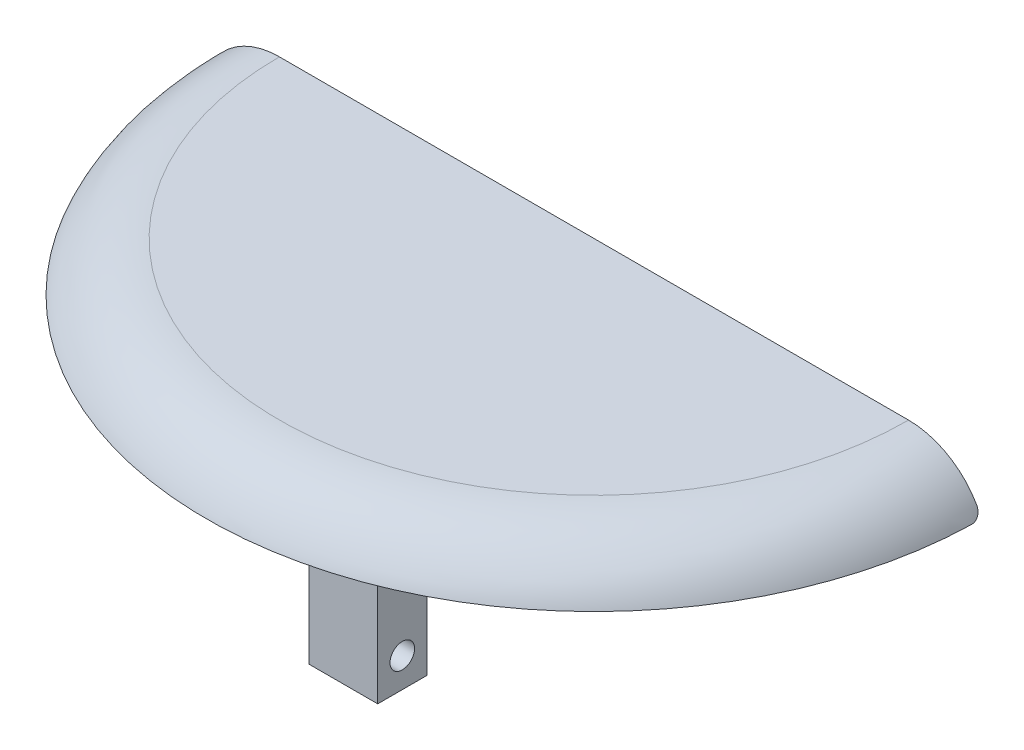
from build123d import *

# Parameters (mm, degrees)
CUT_EXTRUDE3_DEPTH           = 60
CUT_EXTRUDE5_DEPTH           = 2
CUT_EXTRUDE5_DEPTH_BACK      = 30
SKETCH9_R                    = 38
SKETCH9_R_2                  = 23
SKETCH19_W                   = 12
SKETCH19_H                   = 36.5
CUT_REVOLVE2_ANGLE           = 65
CUT_REVOLVE2_OTHER_WAY_ANGLE = 65
SKETCH21_W                   = 3.25
SKETCH21_H                   = 4
BOSS_EXTRUDE3_DEPTH          = 1.35
CIRPATTERN1_COUNT            = 5
CUT_EXTRUDE9_START           = -5
CUT_EXTRUDE9_DEPTH           = 5
SKETCH23_R                   = 10.5
CUT_EXTRUDE10_DEPTH          = 10
SKETCH24_W                   = 15
SKETCH24_H                   = 8
BOSS_EXTRUDE4_DEPTH          = 8
SKETCH26_W                   = 10
SKETCH26_H                   = 6
CUT_EXTRUDE11_DEPTH          = 10
SKETCH27_W                   = 4
SKETCH27_H                   = 5
CUT_EXTRUDE12_DEPTH          = 5
CUT_EXTRUDE14_DEPTH          = 2
CUT_EXTRUDE14_DEPTH_BACK     = 30
SKETCH29_R                   = 1
CUT_EXTRUDE15_DEPTH          = 15
FILLET1_R                    = 6
FILLET2_R                    = 8
INTERSECT1_DEPTH             = 58.427876097
SKETCH31_W                   = 7
SKETCH31_H                   = 5
BOSS_EXTRUDE7_DEPTH          = 15
SKETCH32_R                   = 1.25
CUT_EXTRUDE16_DEPTH          = 7.5
FILLET3_R                    = 1


# Read off the part's stored shape, not the designer's step: Cut-Extrude9, Intersect1
with BuildPart() as part:
    # Sketch1 → Revolve1 (revolve)
    with BuildSketch(Plane.XY, mode=Mode.PRIVATE) as revolve1_sk:
        with BuildLine():
            Line((0, 63.427876097), (32, 63.427876097))
            ThreePointArc((32, 63.427876097), (37.656854249, 61.084730346), (40, 55.427876097))
            Line((40, 55.427876097), (40, 28.846818009))
            ThreePointArc((40, 28.846818009), (38.792081772, 24.082439968), (35.460140376, 20.469057744))
            Line((35.460140376, 20.469057744), (28.539859624, 15.958818353))
            ThreePointArc((28.539859624, 15.958818353), (25.207918228, 12.345436129), (24, 7.581058088))
            Line((24, 7.581058088), (24, 3.25))
            Line((24, 3.25), (24.35, 3))
            Line((24.35, 3), (24.35, 0))
            Line((24.35, 0), (22.5, 0))
            Line((22.5, 0), (22.5, 12.5))
            ThreePointArc((22.5, 12.5), (22.353553391, 12.853553391), (22, 13))
            Line((22, 13), (0, 13))
            Line((0, 13), (0, 63.427876097))
        make_face()
    revolve(revolve1_sk.sketch.rotate(Axis((0, 0, 0), (0, 1, 0)), 90), axis=Axis((0, 0, 0), (0, 1, 0)))

    # Sketch11 → Cut-Extrude3 (cut)
    with BuildSketch(Plane(origin=(0, 13, 0), x_dir=(-1, 0, 0), z_dir=(0, -1, 0))):
        with BuildLine():
            Line((-21, 0), (21, 0))
            ThreePointArc((21, 0), (0, 21), (-21, 0))
        make_face()
    extrude(amount=-CUT_EXTRUDE3_DEPTH, mode=Mode.SUBTRACT)

    # Sketch9 → Cut-Extrude5 (cut, two sides: drawn at the far end of the back side and taken through both)
    with BuildSketch(Plane(origin=(0, 55.427876097, 0), x_dir=(1, 0, 0), z_dir=(0, 1, 0)).offset(-CUT_EXTRUDE5_DEPTH_BACK)):
        with Locations(Location((0, 0, 0), (0, 0, 270))):
            Circle(SKETCH9_R)
        with Locations(Location((0, 0, 0), (0, 0, 270))):
            Circle(SKETCH9_R_2, mode=Mode.SUBTRACT)
    extrude(amount=CUT_EXTRUDE5_DEPTH + CUT_EXTRUDE5_DEPTH_BACK, mode=Mode.SUBTRACT)

    # Sketch19 → Cut-Revolve2 (revolve, cut)
    with BuildSketch(Plane(origin=(0, 0, 0), x_dir=(0, 0, -1), z_dir=(1, 0, 0))):
        with Locations((-41.064715832, 37.177876097)):
            Rectangle(SKETCH19_W, SKETCH19_H)
    revolve(axis=Axis((0, 0, 0), (0, 1, 0)), revolution_arc=CUT_REVOLVE2_ANGLE, mode=Mode.SUBTRACT)

    # Sketch19 → Cut-Revolve2 other way (revolve, cut)
    with BuildSketch(Plane(origin=(0, 0, 0), x_dir=(0, 0, -1), z_dir=(1, 0, 0))):
        with Locations((-41.064715832, 37.177876097)):
            Rectangle(SKETCH19_W, SKETCH19_H)
    revolve(axis=Axis((0, 0, 0), (0, -1, 0)), revolution_arc=CUT_REVOLVE2_OTHER_WAY_ANGLE, mode=Mode.SUBTRACT)

    # Sketch21 → Boss-Extrude3 (add)
    with BuildSketch(Plane(origin=(0, 0, 22.5), x_dir=(-1, 0, 0), z_dir=(0, 0, -1))):
        with Locations((0, 2)):
            Rectangle(SKETCH21_W, SKETCH21_H)
    boss_extrude3 = extrude(amount=BOSS_EXTRUDE3_DEPTH)

    # CirPattern1: Boss-Extrude3 ×5 about axis
    cirpattern1_axis = Axis((0, 0, 0), (0, 1, 0))
    for i in range(1, CIRPATTERN1_COUNT):
        add(boss_extrude3.rotate(cirpattern1_axis, i * 360 / CIRPATTERN1_COUNT))

    # Cut-Extrude9 outline → Cut-Extrude9 (cut)
    with BuildSketch(Plane(origin=(0, 63.427876097, 0), x_dir=(1, 0, 0), z_dir=(0, 1, 0)).offset(CUT_EXTRUDE9_START)):
        with BuildLine():
            ThreePointArc((40, 0), (0, 40), (-40, 0))
            Line((-40, 0), (-21, 0))
            ThreePointArc((-21, 0), (0, 21), (21, 0))
            Line((21, 0), (40, 0))
        make_face()
    extrude(amount=CUT_EXTRUDE9_DEPTH, mode=Mode.SUBTRACT)

    # Sketch23 → Cut-Extrude10 (cut)
    with BuildSketch(Plane(origin=(0, 0, -40), x_dir=(-1, 0, 0), z_dir=(0, 0, -1))):
        with Locations((0, 42.137876097)):
            Circle(SKETCH23_R)
    extrude(amount=-CUT_EXTRUDE10_DEPTH, mode=Mode.SUBTRACT)

    # Sketch24 → Boss-Extrude4 (add)
    with BuildSketch(Plane(origin=(0, 58.427876097, 0), x_dir=(1, 0, 0), z_dir=(0, 1, 0))):
        with Locations((0, 30)):
            Rectangle(SKETCH24_W, SKETCH24_H)
    extrude(amount=-BOSS_EXTRUDE4_DEPTH)

    # Sketch26 → Cut-Extrude11 (cut)
    with BuildSketch(Plane(origin=(0, 58.427876097, 0), x_dir=(1, 0, 0), z_dir=(0, 1, 0))):
        with Locations((0, 30)):
            Rectangle(SKETCH26_W, SKETCH26_H)
    extrude(amount=-CUT_EXTRUDE11_DEPTH, mode=Mode.SUBTRACT)

    # Sketch27 → Cut-Extrude12 (cut)
    with BuildSketch(Plane(origin=(7.5, 0, 0), x_dir=(0, 0, -1), z_dir=(1, 0, 0))):
        with Locations((30, 53.927876097)):
            Rectangle(SKETCH27_W, SKETCH27_H)
    extrude(amount=-CUT_EXTRUDE12_DEPTH, mode=Mode.SUBTRACT)

    # Sketch28 → Cut-Extrude14 (cut, two sides: drawn at the far end of the back side and taken through both)
    with BuildSketch(Plane(origin=(0, 55.427876097, 0), x_dir=(1, 0, 0), z_dir=(0, 1, 0)).offset(-CUT_EXTRUDE14_DEPTH_BACK)):
        with BuildLine():
            Line((-22.912878475, -2), (22.912878475, -2))
            ThreePointArc((22.912878475, -2), (0, -23), (-22.912878475, -2))
        make_face()
    extrude(amount=CUT_EXTRUDE14_DEPTH + CUT_EXTRUDE14_DEPTH_BACK, mode=Mode.SUBTRACT)

    # Sketch29 → Cut-Extrude15 (cut)
    with BuildSketch(Plane(origin=(0, 0, 0), x_dir=(-1, 0, 0), z_dir=(0, 0, -1))):
        with Locations((-30.416198487, 60.927876097)):
            Circle(SKETCH29_R)
        with Locations((30.416198487, 60.927876097)):
            Circle(SKETCH29_R)
        with Locations((0, 60.927876097)):
            Circle(SKETCH29_R)
    extrude(amount=-CUT_EXTRUDE15_DEPTH, mode=Mode.SUBTRACT)

    # Fillet1
    fillet1_edges = [part.edges().sort_by_distance(p)[0] for p in [
        (21, 35.713938048, 0),
        (-21, 35.713938048, 0),
    ]]
    fillet(fillet1_edges, radius=FILLET1_R)

    # Fillet2
    fillet2_edges = [part.edges().sort_by_distance(p)[0] for p in [
        (-22.912878475, 41.427876097, 2),
        (22.912878475, 41.427876097, 2),
    ]]
    fillet(fillet2_edges, radius=FILLET2_R)

    # Intersect1 outline → Intersect1 (cut)
    with BuildSketch(Plane(origin=(0, 0, 0), x_dir=(1, 0, 0), z_dir=(0, 1, 0))):
        with BuildLine():
            Line((-37.508702776, -13.895942431), (-42, -15.355253362))
            Line((-42, -15.355253362), (-42, -41))
            Line((-42, -41), (42, -41))
            Line((42, -41), (42, -15.355253362))
            Line((42, -15.355253362), (37.508702776, -13.895942431))
            ThreePointArc((37.508702776, -13.895942431), (0, 40), (-37.508702776, -13.895942431))
        make_face()
        with BuildLine():
            ThreePointArc((19.246817919, 8.4), (18.767687244, 2.713664655), (13.747727085, 0))
            Line((13.747727085, 0), (-13.747727085, 0))
            ThreePointArc((-13.747727085, 0), (-18.767687244, 2.713664655), (-19.246817919, 8.4))
            ThreePointArc((-19.246817919, 8.4), (0, 21), (19.246817919, 8.4))
        make_face(mode=Mode.SUBTRACT)
    extrude(amount=INTERSECT1_DEPTH, mode=Mode.SUBTRACT)

    # Sketch31 → Boss-Extrude7 (add)
    with BuildSketch(Plane(origin=(0, 58.427876097, 0), x_dir=(1, 0, 0), z_dir=(0, 1, 0))):
        with Locations((6.5, -29.5)):
            Rectangle(SKETCH31_W, SKETCH31_H)
    extrude(amount=-BOSS_EXTRUDE7_DEPTH)

    # Sketch32 → Cut-Extrude16 (cut)
    with BuildSketch(Plane(origin=(10, 0, 0), x_dir=(0, 0, -1), z_dir=(1, 0, 0))):
        with Locations((-29.5, 46.427876097)):
            Circle(SKETCH32_R)
    extrude(amount=-CUT_EXTRUDE16_DEPTH, mode=Mode.SUBTRACT)

    # Fillet3
    fillet3_edges = [part.edges().sort_by_distance(p)[0] for p in [
        (0, 58.427876097, 0),
    ]]
    fillet(fillet3_edges, radius=FILLET3_R)


solid = part.part
